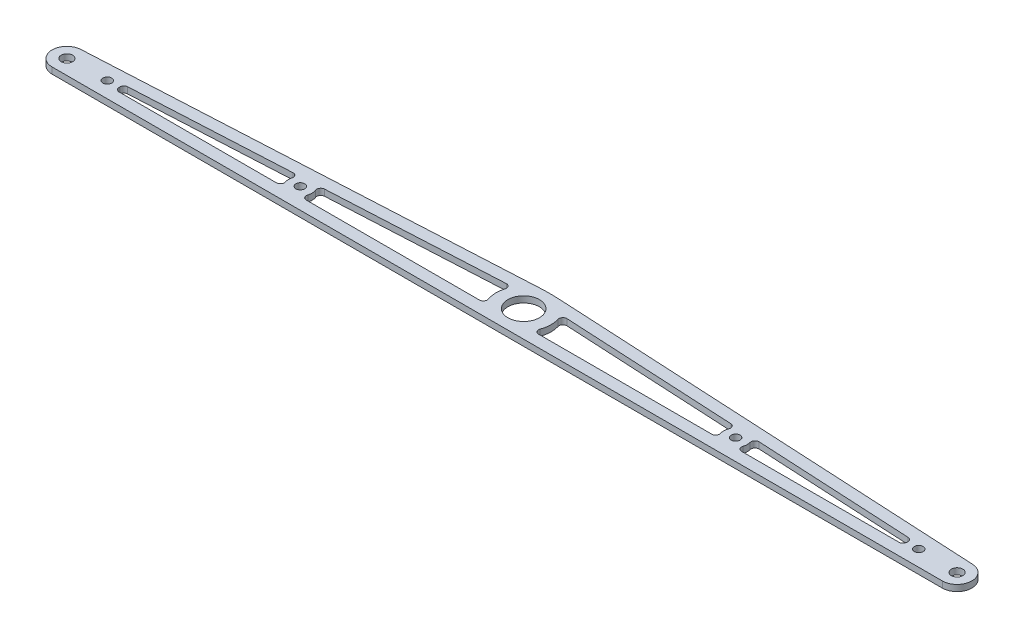
from build123d import *

# Parameters (mm, degrees)
BASE_FLANGE1_DEPTH             = 3.175
SKETCH11_R                     = 8
CUT_EXTRUDE1_CENTER_HOLE_DEPTH = 234.912720759
M5_CLEARANCE_HOLE1_EDGE_D      = 5.8
CUT_EXTRUDE2_DEPTH             = 234.912720759
BOSS_EXTRUDE3_DEPTH            = 3.175
M4_CLEARANCE_HOLE1_D           = 4.5
FILLET1_R                      = 2
FILLET1_OF_MIRROR1_R           = 2
FILLET2_R                      = 100


# Sheet-metal steps are written as plain solids
with BuildPart() as part:
    # Sketch1 → Base-Flange1 (new body)
    with BuildSketch(Plane(origin=(0, 0, 0), x_dir=(1, 0, 0), z_dir=(0, 1, 0))):
        with BuildLine():
            Line((226, -13.432371654), (-226, -13.432371654))
            ThreePointArc((-226, -13.432371654), (-233.502570944, -6.12369062), (-226.392788824, 1.567628346))
            Line((-226.392788824, 1.567628346), (0, 13.432371654))
            Line((0, 13.432371654), (226.392788824, 1.567628346))
            ThreePointArc((226.392788824, 1.567628346), (233.502570944, -6.12369062), (226, -13.432371654))
        make_face()
    extrude(amount=-BASE_FLANGE1_DEPTH)

    # Sketch11 → Cut-Extrude1_Center Hole (cut, through all)
    with BuildSketch(Plane(origin=(0, 0, 0), x_dir=(1, 0, 0), z_dir=(0, 1, 0))):
        with Locations(Location((0, 0, 0), (0, 0, 270))):
            Circle(SKETCH11_R)
    extrude(amount=-CUT_EXTRUDE1_CENTER_HOLE_DEPTH, mode=Mode.SUBTRACT)

    # M5 Clearance Hole1_Edge (through all)
    with Locations(Plane(origin=(0, 0, 0), x_dir=(1, 0, 0), z_dir=(0, 1, 0))):
        with Locations((-226, -5.927228885)):
            m5_clearance_hole1_edge = Hole(M5_CLEARANCE_HOLE1_EDGE_D / 2)

    # Sketch12 → Cut-Extrude2 (cut, through all)
    with BuildSketch(Plane(origin=(0, 0, 0), x_dir=(1, 0, 0), z_dir=(0, 1, 0))):
        with BuildLine():
            Line((-209.269000639, -3.543186018), (-113.515692218, 1.475032235))
            Line((-113.515692218, 1.475032235), (-113.515692218, -7.432371654))
            Line((-113.515692218, -7.432371654), (-209.167158729, -7.432371654))
            ThreePointArc((-209.167158729, -7.432371654), (-209.105791208, -5.484838459), (-209.269000639, -3.543186018))
        make_face()
        with BuildLine():
            Line((-107.515692218, 1.789478911), (-107.515692218, -7.432371654))
            Line((-107.515692218, -7.432371654), (-11.864225706, -7.432371654))
            ThreePointArc((-11.864225706, -7.432371654), (-13.994914166, -0.377329415), (-12.247479508, 6.782274375))
            Line((-12.247479508, 6.782274375), (-107.515692218, 1.789478911))
        make_face()
    cut_extrude2 = extrude(amount=-CUT_EXTRUDE2_DEPTH, mode=Mode.SUBTRACT)

    # Sketch16 → Boss-Extrude3 (add)
    with BuildSketch(Plane(origin=(0, 0, 0), x_dir=(1, 0, 0), z_dir=(0, 1, 0))):
        with BuildLine():
            Line((-113.515692218, -7.432371654), (-113.515692218, -2.978669709))
            Line((-113.515692218, -2.978669709), (-113.515692218, 1.475032235))
            Line((-113.515692218, 1.475032235), (-114.686004205, 1.413698783))
            ThreePointArc((-114.686004205, 1.413698783), (-116.513510347, -3.061853233), (-114.447375484, -7.432371654))
            Line((-114.447375484, -7.432371654), (-113.515692218, -7.432371654))
        make_face()
        with BuildLine():
            Line((-107.515692218, 1.789478911), (-107.515692218, -2.821446372))
            Line((-107.515692218, -2.821446372), (-107.515692218, -7.432371654))
            Line((-107.515692218, -7.432371654), (-106.584008951, -7.432371654))
            ThreePointArc((-106.584008951, -7.432371654), (-105.057208014, -5.391031786), (-104.515692218, -2.900058041))
            ThreePointArc((-104.515692218, -2.900058041), (-105.122208313, -0.271307126), (-106.819136008, 1.825983875))
            Line((-106.819136008, 1.825983875), (-107.515692218, 1.789478911))
        make_face()
        with BuildLine():
            ThreePointArc((-200, -5.40297223), (-200.117942339, -4.219165794), (-200.467132559, -3.081899659))
            Line((-200.467132559, -3.081899659), (-209.269000639, -3.543186018))
            ThreePointArc((-209.269000639, -3.543186018), (-209.105791208, -5.484838459), (-209.167158729, -7.432371654))
            Line((-209.167158729, -7.432371654), (-200.353626121, -7.432371654))
            ThreePointArc((-200.353626121, -7.432371654), (-200.089067617, -6.432961727), (-200, -5.40297223))
        make_face()
        with BuildLine():
            Line((-209.269000639, -3.543186018), (-200.467132559, -3.081899659))
            ThreePointArc((-200.467132559, -3.081899659), (-211.997958883, -5.559462595), (-200.353626121, -7.432371654))
            Line((-200.353626121, -7.432371654), (-209.167158729, -7.432371654))
            ThreePointArc((-209.167158729, -7.432371654), (-209.105791208, -5.484838459), (-209.269000639, -3.543186018))
        make_face()
    boss_extrude3 = extrude(amount=-BOSS_EXTRUDE3_DEPTH)

    # M4 Clearance Hole1 (through all)
    with Locations(Plane(origin=(0, 0, 0), x_dir=(1, 0, 0), z_dir=(0, 1, 0))):
        with Locations((-206, -5.40297223), (-110.515692218, -2.900058041)):
            m4_clearance_hole1 = Hole(M4_CLEARANCE_HOLE1_D / 2)

    # Fillet1
    fillet1_edges = [part.edges().sort_by_distance(p)[0] for p in [
        (-12.247479508, -1.5875, -6.782274375),
        (-11.864225706, -1.5875, 7.432371654),
        (-114.447375484, -1.5875, 7.432371654),
        (-114.686004205, -1.5875, -1.413698783),
        (-106.819136008, -1.5875, -1.825983875),
        (-106.584008951, -1.5875, 7.432371654),
        (-200.467132559, -1.5875, 3.081899659),
        (-200.353626121, -1.5875, 7.432371654),
    ]]
    fillet(fillet1_edges, radius=FILLET1_R)

    # Mirror1: M5 Clearance Hole1_Edge, Cut-Extrude2, Boss-Extrude3, M4 Clearance Hole1 across plane
    add(m5_clearance_hole1_edge.mirror(Plane(origin=(0, 0, 0), x_dir=(0, 0, 1), z_dir=(1, 0, 0))), mode=Mode.SUBTRACT)
    add(cut_extrude2.mirror(Plane(origin=(0, 0, 0), x_dir=(0, 0, 1), z_dir=(1, 0, 0))), mode=Mode.SUBTRACT)
    add(boss_extrude3.mirror(Plane(origin=(0, 0, 0), x_dir=(0, 0, 1), z_dir=(1, 0, 0))))
    add(m4_clearance_hole1.mirror(Plane(origin=(0, 0, 0), x_dir=(0, 0, 1), z_dir=(1, 0, 0))), mode=Mode.SUBTRACT)

    # Fillet1 of Mirror1
    fillet1_of_mirror1_edges = [part.edges().sort_by_distance(p)[0] for p in [
        (12.247479508, -1.5875, -6.782274375),
        (11.864225706, -1.5875, 7.432371654),
        (114.447375484, -1.5875, 7.432371654),
        (114.686004205, -1.5875, -1.413698783),
        (106.819136008, -1.5875, -1.825983875),
        (106.584008951, -1.5875, 7.432371654),
        (200.467132559, -1.5875, 3.081899659),
        (200.353626121, -1.5875, 7.432371654),
    ]]
    fillet(fillet1_of_mirror1_edges, radius=FILLET1_OF_MIRROR1_R)

    # Fillet2
    fillet2_edges = [part.edges().sort_by_distance(p)[0] for p in [
        (0, -1.5875, -13.432371654),
    ]]
    fillet(fillet2_edges, radius=FILLET2_R)


solid = part.part
